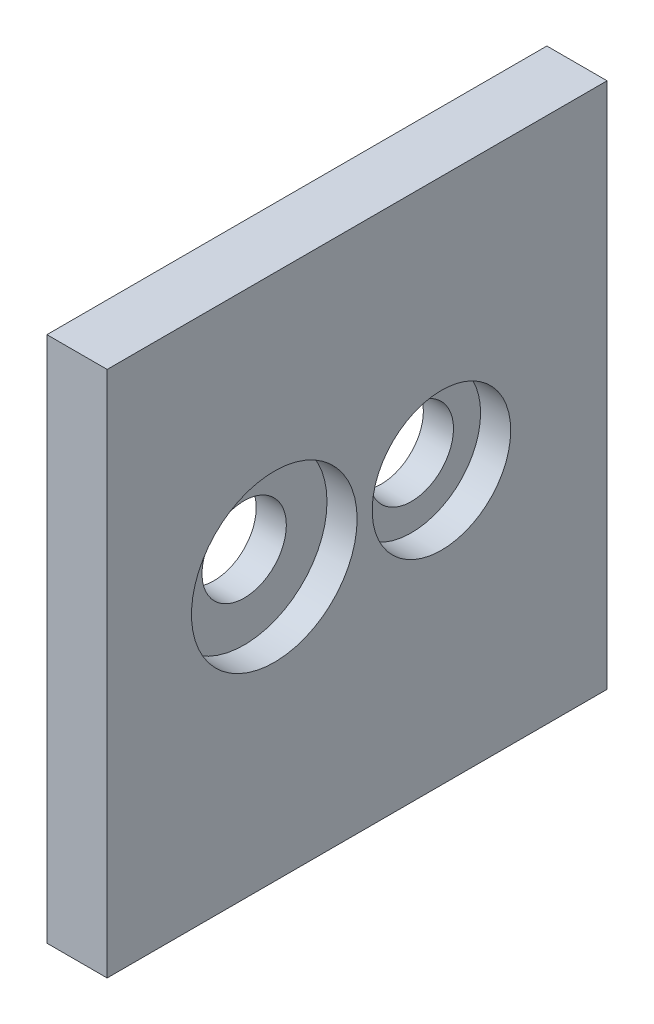
from build123d import *

# Parameters (mm, degrees)
SKETCH1_W           = 20
SKETCH1_H           = 166
BOSS_EXTRUDE1_DEPTH = 175
SKETCH2_R           = 14
CUT_EXTRUDE1_DEPTH  = 175
SKETCH3_R           = 27.5
SKETCH3_R_2         = 23
CUT_EXTRUDE2_DEPTH  = 10


with BuildPart() as part:
    # Sketch1 → Boss-Extrude1 (new body)
    with BuildSketch(Plane(origin=(0, 0, 0), x_dir=(1, 0, 0), z_dir=(0, 1, 0))):
        Rectangle(SKETCH1_W, SKETCH1_H)
    extrude(amount=BOSS_EXTRUDE1_DEPTH)

    # Sketch2 → Cut-Extrude1 (cut)
    with BuildSketch(Plane(origin=(10, 0, 0), x_dir=(0, 0, -1), z_dir=(1, 0, 0))):
        with Locations((-27.5, 90.5)):
            Circle(SKETCH2_R)
        with Locations((28, 90.5)):
            Circle(SKETCH2_R)
    extrude(amount=-CUT_EXTRUDE1_DEPTH, mode=Mode.SUBTRACT)

    # Sketch3 → Cut-Extrude2 (cut)
    with BuildSketch(Plane(origin=(10, 0, 0), x_dir=(0, 0, -1), z_dir=(1, 0, 0))):
        with Locations((-27.5, 90.5)):
            Circle(SKETCH3_R)
        with Locations((28, 90.5)):
            Circle(SKETCH3_R_2)
    extrude(amount=-CUT_EXTRUDE2_DEPTH, mode=Mode.SUBTRACT)


solid = part.part
